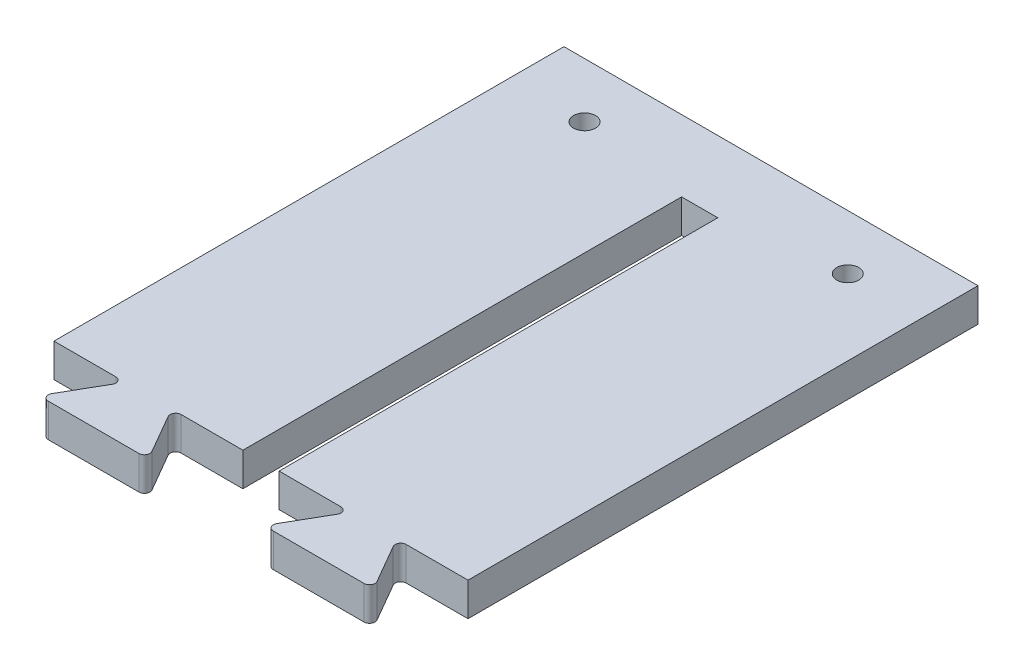
from build123d import *

# Parameters (mm, degrees)
BOSS_EXTRUDE1_DEPTH      = 3.05
FILLET1_R                = 0.5
SKETCH3_W                = 3.3
SKETCH3_H                = 40
SKETCH3_H_2              = 1
CUT_EXTRUDE2_DEPTH       = 51.467248043
M3_TAPPED_DAMPER_HOLES_D = 2
SKETCH9_W                = 0.5
SKETCH9_H                = 46.5
CUT_EXTRUDE4_DEPTH       = 51.467248043


with BuildPart() as part:
    # Sketch1 → Boss-Extrude1 (new body)
    with BuildSketch(Plane(origin=(0, 0, 0), x_dir=(1, 0, 0), z_dir=(0, 1, 0))):
        Polygon((-19.375, 0), (-19.375, 46.5), (19.375, 46.5), (19.375, 0), (12.375, 0), (15.261751346, -5), (5.261751346, -5), (8.148502692, 0), (-8.148502692, 0), (-5.261751346, -5), (-15.261751346, -5), (-12.375, 0), align=None)
    extrude(amount=BOSS_EXTRUDE1_DEPTH)

    # Fillet1
    fillet1_edges = [part.edges().sort_by_distance(p)[0] for p in [
        (12.375, 1.525, 0),
        (15.261751346, 1.525, 5),
        (5.261751346, 1.525, 5),
        (8.148502692, 1.525, 0),
        (-8.148502692, 1.525, 0),
        (-5.261751346, 1.525, 5),
        (-15.261751346, 1.525, 5),
        (-12.375, 1.525, 0),
    ]]
    fillet(fillet1_edges, radius=FILLET1_R)

    # Sketch3 → Cut-Extrude2 (cut, through all)
    with BuildSketch(Plane(origin=(0, 3.05, 0), x_dir=(1, 0, 0), z_dir=(0, 1, 0))):
        with Locations((0, 20)):
            Rectangle(SKETCH3_W, SKETCH3_H)
        with Locations((0, -1.7)):
            Rectangle(SKETCH3_W, SKETCH3_H_2)
    extrude(amount=-CUT_EXTRUDE2_DEPTH, mode=Mode.SUBTRACT)

    # M3 Tapped Damper Holes (through all)
    with Locations(Plane(origin=(0, 3.05, 0), x_dir=(1, 0, 0), z_dir=(0, 1, 0))):
        with Locations((-12, 41.5), (12, 41.5)):
            Hole(M3_TAPPED_DAMPER_HOLES_D / 2)

    # Sketch9 → Cut-Extrude4 (cut, through all)
    with BuildSketch(Plane(origin=(0, 3.05, 0), x_dir=(1, 0, 0), z_dir=(0, 1, 0))):
        with Locations((-19.125, 23.25)):
            Rectangle(SKETCH9_W, SKETCH9_H)
        with Locations((19.125, 23.25)):
            Rectangle(SKETCH9_W, SKETCH9_H)
    extrude(amount=-CUT_EXTRUDE4_DEPTH, mode=Mode.SUBTRACT)


solid = part.part
